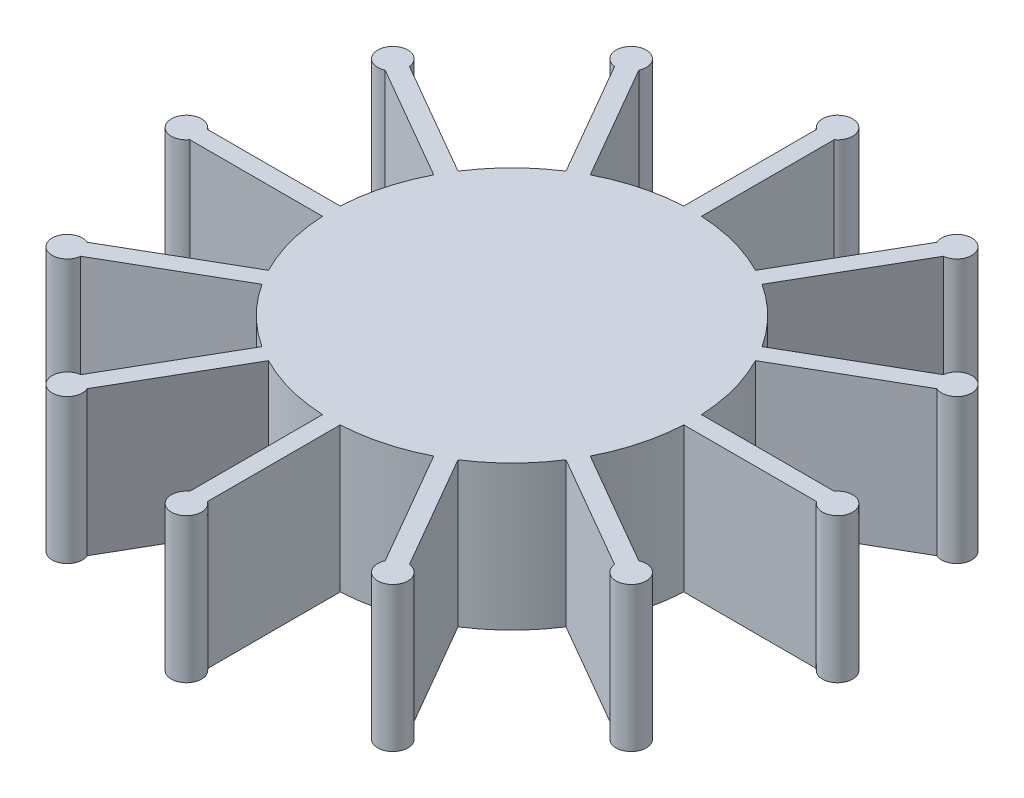
from build123d import *

# Parameters (mm, degrees)
BOSS_EXTRUDE1_DEPTH = 12


with BuildPart() as part:
    # Sketch1 → Boss-Extrude1 (new body)
    with BuildSketch(Plane(origin=(0, 0, 0), x_dir=(1, 0, 0), z_dir=(0, 1, 0))):
        with BuildLine():
            Line((-0.735819468, 25.98952006), (-0.735819468, 14.981941453))
            ThreePointArc((-0.735819468, 14.981941453), (-3.882285677, 14.488887394), (-6.853732374, 13.342651631))
            Line((-6.853732374, 13.342651631), (-12.357521678, 22.875494338))
            ThreePointArc((-12.357521678, 22.875494338), (-14.125, 24.465217657), (-13.631998382, 22.13967487))
            Line((-13.631998382, 22.13967487), (-8.128209079, 12.606832162))
            ThreePointArc((-8.128209079, 12.606832162), (-10.606601718, 10.606601718), (-12.606832162, 8.128209079))
            Line((-12.606832162, 8.128209079), (-22.13967487, 13.631998382))
            ThreePointArc((-22.13967487, 13.631998382), (-24.465217657, 14.125), (-22.875494338, 12.357521678))
            Line((-22.875494338, 12.357521678), (-13.342651631, 6.853732374))
            ThreePointArc((-13.342651631, 6.853732374), (-14.488887394, 3.882285677), (-14.981941453, 0.735819468))
            Line((-14.981941453, 0.735819468), (-25.98952006, 0.735819468))
            ThreePointArc((-25.98952006, 0.735819468), (-28.25, 0), (-25.98952006, -0.735819468))
            Line((-25.98952006, -0.735819468), (-14.981941453, -0.735819468))
            ThreePointArc((-14.981941453, -0.735819468), (-14.488887394, -3.882285677), (-13.342651631, -6.853732374))
            Line((-13.342651631, -6.853732374), (-22.875494338, -12.357521678))
            ThreePointArc((-22.875494338, -12.357521678), (-24.465217657, -14.125), (-22.13967487, -13.631998382))
            Line((-22.13967487, -13.631998382), (-12.606832162, -8.128209079))
            ThreePointArc((-12.606832162, -8.128209079), (-10.606601718, -10.606601718), (-8.128209079, -12.606832162))
            Line((-8.128209079, -12.606832162), (-13.631998382, -22.13967487))
            ThreePointArc((-13.631998382, -22.13967487), (-14.125, -24.465217657), (-12.357521678, -22.875494338))
            Line((-12.357521678, -22.875494338), (-6.853732374, -13.342651631))
            ThreePointArc((-6.853732374, -13.342651631), (-3.882285677, -14.488887394), (-0.735819468, -14.981941453))
            Line((-0.735819468, -14.981941453), (-0.735819468, -25.98952006))
            ThreePointArc((-0.735819468, -25.98952006), (0, -28.25), (0.735819468, -25.98952006))
            Line((0.735819468, -25.98952006), (0.735819468, -14.981941453))
            ThreePointArc((0.735819468, -14.981941453), (3.882285677, -14.488887394), (6.853732374, -13.342651631))
            Line((6.853732374, -13.342651631), (12.357521678, -22.875494338))
            ThreePointArc((12.357521678, -22.875494338), (14.125, -24.465217657), (13.631998382, -22.13967487))
            Line((13.631998382, -22.13967487), (8.128209079, -12.606832162))
            ThreePointArc((8.128209079, -12.606832162), (10.606601718, -10.606601718), (12.606832162, -8.128209079))
            Line((12.606832162, -8.128209079), (22.13967487, -13.631998382))
            ThreePointArc((22.13967487, -13.631998382), (24.465217657, -14.125), (22.875494338, -12.357521678))
            Line((22.875494338, -12.357521678), (13.342651631, -6.853732374))
            ThreePointArc((13.342651631, -6.853732374), (14.488887394, -3.882285677), (14.981941453, -0.735819468))
            Line((14.981941453, -0.735819468), (25.98952006, -0.735819468))
            ThreePointArc((25.98952006, -0.735819468), (28.25, 0), (25.98952006, 0.735819468))
            Line((25.98952006, 0.735819468), (14.981941453, 0.735819468))
            ThreePointArc((14.981941453, 0.735819468), (14.488887394, 3.882285677), (13.342651631, 6.853732374))
            Line((13.342651631, 6.853732374), (22.875494338, 12.357521678))
            ThreePointArc((22.875494338, 12.357521678), (24.465217657, 14.125), (22.13967487, 13.631998382))
            Line((22.13967487, 13.631998382), (12.606832162, 8.128209079))
            ThreePointArc((12.606832162, 8.128209079), (10.606601718, 10.606601718), (8.128209079, 12.606832162))
            Line((8.128209079, 12.606832162), (13.631998382, 22.13967487))
            ThreePointArc((13.631998382, 22.13967487), (14.125, 24.465217657), (12.357521678, 22.875494338))
            Line((12.357521678, 22.875494338), (6.853732374, 13.342651631))
            ThreePointArc((6.853732374, 13.342651631), (3.882285677, 14.488887394), (0.735819468, 14.981941453))
            Line((0.735819468, 14.981941453), (0.735819468, 25.98952006))
            ThreePointArc((0.735819468, 25.98952006), (0, 28.25), (-0.735819468, 25.98952006))
        make_face()
    extrude(amount=BOSS_EXTRUDE1_DEPTH)


solid = part.part
